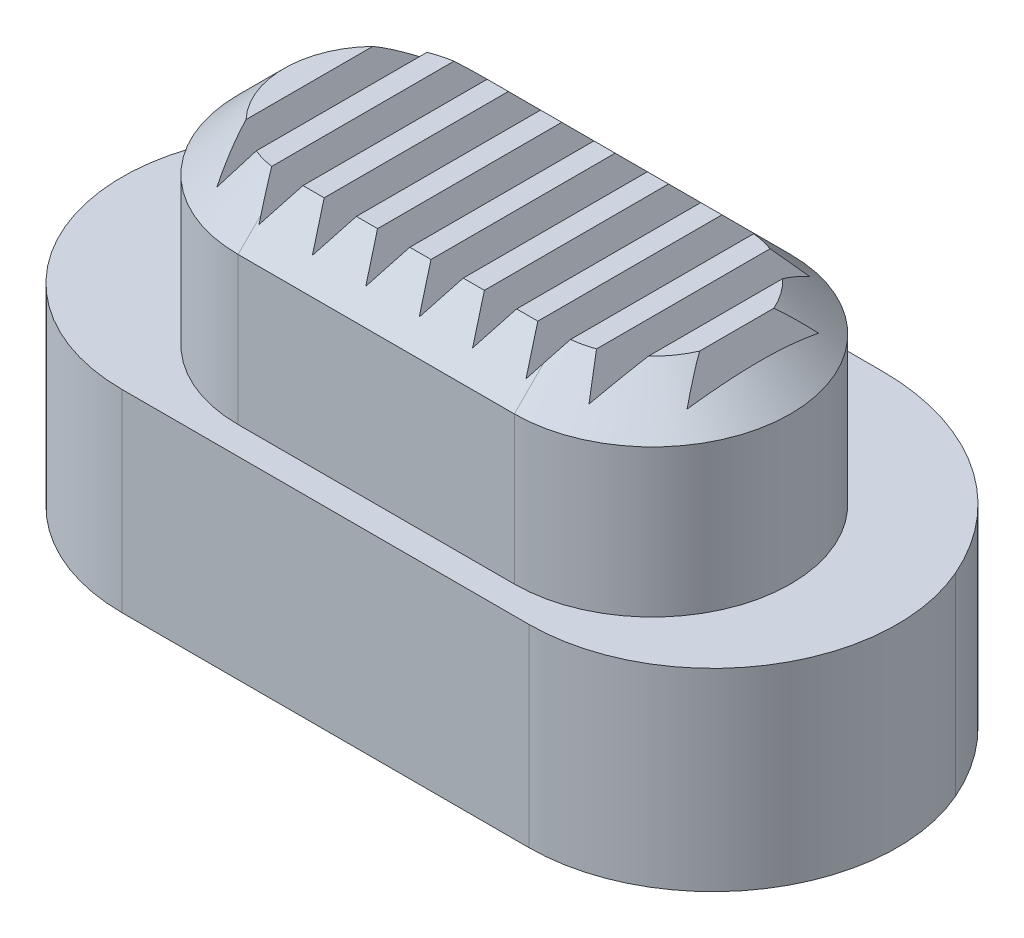
from build123d import *

# Parameters (mm, degrees)
EXTRUDE_1_DEPTH     = 4.2
CUT_EXTRUDE_1_REACH = 15.662
SKETCH_3_R          = 1.75
EXTRUDE_2_DEPTH     = 4.2
CHAMFER_1_SIZE      = 1
CUT_EXTRUDE_2_REACH = 15.662
SKETCH_5_W          = 13.93974063
SKETCH_5_H          = 1.4
FILLET_1_R          = 4
CUT_EXTRUDE_3_REACH = 18.927


with BuildPart() as part:
    # 草图1 → 凸台-拉伸1 (new body)
    with BuildSketch(Plane(origin=(0, 0, 0), x_dir=(1, 0, 0), z_dir=(0, 1, 0))):
        with BuildLine():
            Line((0, 5), (7, 5))
            ThreePointArc((7, 5), (12, 0), (7, -5))
            Line((7, -5), (0, -5))
            ThreePointArc((0, -5), (-5, 0), (0, 5))
        make_face()
    extrude(amount=EXTRUDE_1_DEPTH)

    # 草图3 → 切除-拉伸1 (cut, up to next)
    with BuildSketch(Plane.XZ, mode=Mode.PRIVATE) as cut_extrude_1_sk1:
        Circle(SKETCH_3_R)
    cut_extrude_1_tool1 = extrude(cut_extrude_1_sk1.sketch, amount=-CUT_EXTRUDE_1_REACH, mode=Mode.PRIVATE) & part.part
    add(cut_extrude_1_tool1.solids().sort_by_distance((0, 0, 0))[0], mode=Mode.SUBTRACT)

    # 草图4 → 凸台-拉伸2 (add)
    with BuildSketch(Plane(origin=(0, 4.2, 0), x_dir=(1, 0, 0), z_dir=(0, 1, 0))):
        with BuildLine():
            Line((1, 3), (7, 3))
            ThreePointArc((7, 3), (10, 0), (7, -3))
            Line((7, -3), (1, -3))
            ThreePointArc((1, -3), (-2, 0), (1, 3))
        make_face()
    extrude(amount=EXTRUDE_2_DEPTH)

    # 倒角1
    chamfer_1_edges = [part.edges().sort_by_distance(p)[0] for p in [
        (4, 8.4, -3),
        (-2, 8.4, 0),
        (10, 8.4, 0),
        (4, 8.4, 3),
    ]]
    chamfer(chamfer_1_edges, length=CHAMFER_1_SIZE)

    # 草图5 → 切除-拉伸2 (cut, up to next)
    with BuildSketch(Plane(origin=(0, 4.2, 0), x_dir=(1, 0, 0), z_dir=(0, 1, 0)), mode=Mode.PRIVATE) as cut_extrude_2_sk1:
        with Locations((3.5, -4.3)):
            Rectangle(SKETCH_5_W, SKETCH_5_H)
    cut_extrude_2_tool1 = extrude(cut_extrude_2_sk1.sketch, amount=-CUT_EXTRUDE_2_REACH, mode=Mode.PRIVATE) & part.part
    add(cut_extrude_2_tool1.solids().sort_by_distance((3.5, 4.2, 4.3))[0], mode=Mode.SUBTRACT)

    # 圆角1
    fillet_1_edges = [part.edges().sort_by_distance(p)[0] for p in [
        (-3.469870315, 2.1, 3.6),
        (10.469870315, 2.1, 3.6),
    ]]
    fillet(fillet_1_edges, radius=FILLET_1_R)

    # 草图6 → 切除-拉伸3 (cut, up to next)
    with BuildSketch(Plane.XY.offset(3.6), mode=Mode.PRIVATE) as cut_extrude_3_sk1:
        Polygon((-0.45, 8.4), (-0.1, 7.793782217), (0.25, 8.4), align=None)
    cut_extrude_3_tool1 = extrude(cut_extrude_3_sk1.sketch, amount=-CUT_EXTRUDE_3_REACH, mode=Mode.PRIVATE) & part.part
    # 草图6 → 切除-拉伸3 (cut, up to next)
    with BuildSketch(Plane.XY.offset(3.6), mode=Mode.PRIVATE) as cut_extrude_3_sk2:
        Polygon((1.41, 8.4), (0.71, 8.4), (1.06, 7.793782217), align=None)
    cut_extrude_3_tool2 = extrude(cut_extrude_3_sk2.sketch, amount=-CUT_EXTRUDE_3_REACH, mode=Mode.PRIVATE) & part.part
    # 草图6 → 切除-拉伸3 (cut, up to next)
    with BuildSketch(Plane.XY.offset(3.6), mode=Mode.PRIVATE) as cut_extrude_3_sk3:
        Polygon((2.57, 8.4), (1.87, 8.4), (2.22, 7.793782217), align=None)
    cut_extrude_3_tool3 = extrude(cut_extrude_3_sk3.sketch, amount=-CUT_EXTRUDE_3_REACH, mode=Mode.PRIVATE) & part.part
    # 草图6 → 切除-拉伸3 (cut, up to next)
    with BuildSketch(Plane.XY.offset(3.6), mode=Mode.PRIVATE) as cut_extrude_3_sk4:
        Polygon((3.73, 8.4), (3.03, 8.4), (3.38, 7.793782217), align=None)
    cut_extrude_3_tool4 = extrude(cut_extrude_3_sk4.sketch, amount=-CUT_EXTRUDE_3_REACH, mode=Mode.PRIVATE) & part.part
    # 草图6 → 切除-拉伸3 (cut, up to next)
    with BuildSketch(Plane.XY.offset(3.6), mode=Mode.PRIVATE) as cut_extrude_3_sk5:
        Polygon((4.89, 8.4), (4.19, 8.4), (4.54, 7.793782217), align=None)
    cut_extrude_3_tool5 = extrude(cut_extrude_3_sk5.sketch, amount=-CUT_EXTRUDE_3_REACH, mode=Mode.PRIVATE) & part.part
    # 草图6 → 切除-拉伸3 (cut, up to next)
    with BuildSketch(Plane.XY.offset(3.6), mode=Mode.PRIVATE) as cut_extrude_3_sk6:
        Polygon((6.05, 8.4), (5.35, 8.4), (5.7, 7.793782217), align=None)
    cut_extrude_3_tool6 = extrude(cut_extrude_3_sk6.sketch, amount=-CUT_EXTRUDE_3_REACH, mode=Mode.PRIVATE) & part.part
    # 草图6 → 切除-拉伸3 (cut, up to next)
    with BuildSketch(Plane.XY.offset(3.6), mode=Mode.PRIVATE) as cut_extrude_3_sk7:
        Polygon((7.21, 8.4), (6.51, 8.4), (6.86, 7.793782217), align=None)
    cut_extrude_3_tool7 = extrude(cut_extrude_3_sk7.sketch, amount=-CUT_EXTRUDE_3_REACH, mode=Mode.PRIVATE) & part.part
    # 草图6 → 切除-拉伸3 (cut, up to next)
    with BuildSketch(Plane.XY.offset(3.6), mode=Mode.PRIVATE) as cut_extrude_3_sk8:
        Polygon((8.37, 8.4), (7.67, 8.4), (8.02, 7.793782217), align=None)
    cut_extrude_3_tool8 = extrude(cut_extrude_3_sk8.sketch, amount=-CUT_EXTRUDE_3_REACH, mode=Mode.PRIVATE) & part.part
    # 草图6 → 切除-拉伸3 (cut, up to next)
    with BuildSketch(Plane.XY.offset(3.6), mode=Mode.PRIVATE) as cut_extrude_3_sk9:
        Polygon((9.53, 8.4), (8.83, 8.4), (9.18, 7.793782217), align=None)
    cut_extrude_3_tool9 = extrude(cut_extrude_3_sk9.sketch, amount=-CUT_EXTRUDE_3_REACH, mode=Mode.PRIVATE) & part.part
    add(cut_extrude_3_tool1.solids().sort_by_distance((-0.1, 8.197927, 3.6))[0], mode=Mode.SUBTRACT)
    add(cut_extrude_3_tool2.solids().sort_by_distance((1.06, 8.197927, 3.6))[0], mode=Mode.SUBTRACT)
    add(cut_extrude_3_tool3.solids().sort_by_distance((2.22, 8.197927, 3.6))[0], mode=Mode.SUBTRACT)
    add(cut_extrude_3_tool4.solids().sort_by_distance((3.38, 8.197927, 3.6))[0], mode=Mode.SUBTRACT)
    add(cut_extrude_3_tool5.solids().sort_by_distance((4.54, 8.197927, 3.6))[0], mode=Mode.SUBTRACT)
    add(cut_extrude_3_tool6.solids().sort_by_distance((5.7, 8.197927, 3.6))[0], mode=Mode.SUBTRACT)
    add(cut_extrude_3_tool7.solids().sort_by_distance((6.86, 8.197927, 3.6))[0], mode=Mode.SUBTRACT)
    add(cut_extrude_3_tool8.solids().sort_by_distance((8.02, 8.197927, 3.6))[0], mode=Mode.SUBTRACT)
    add(cut_extrude_3_tool9.solids().sort_by_distance((9.18, 8.197927, 3.6))[0], mode=Mode.SUBTRACT)


solid = part.part
